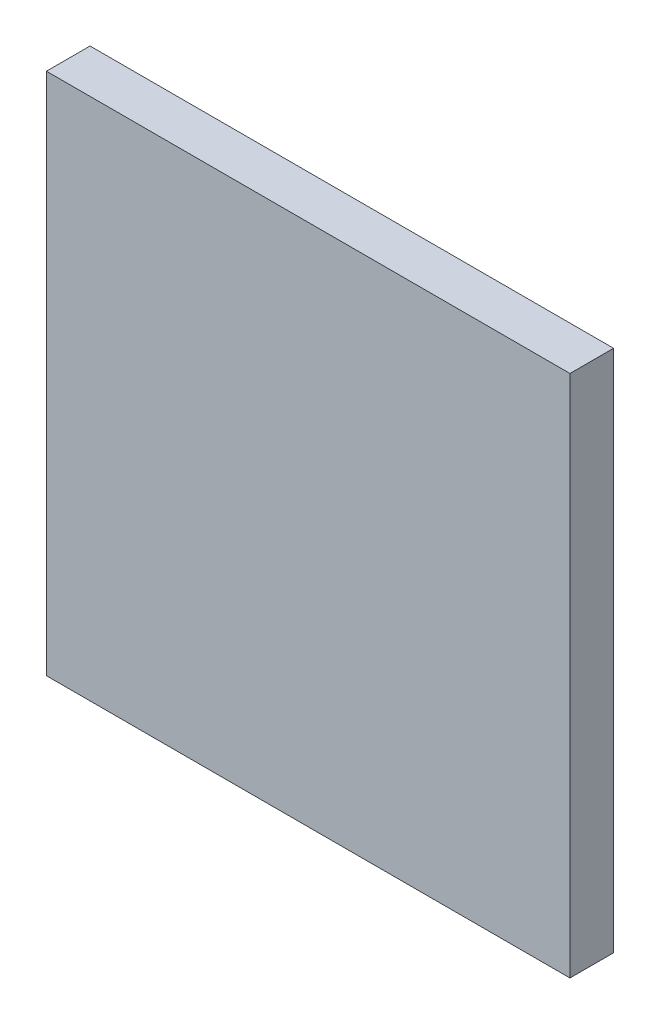
from build123d import *

# Parameters (mm, degrees)
SKETCH1_W           = 0.12
SKETCH1_H           = 0.12
BOSS_EXTRUDE1_DEPTH = 0.01


with BuildPart() as part:
    # Sketch1 → Boss-Extrude1 (new body)
    with BuildSketch(Plane.XY):
        with Locations((0.06, 0.06)):
            Rectangle(SKETCH1_W, SKETCH1_H)
    extrude(amount=BOSS_EXTRUDE1_DEPTH)


solid = part.part
